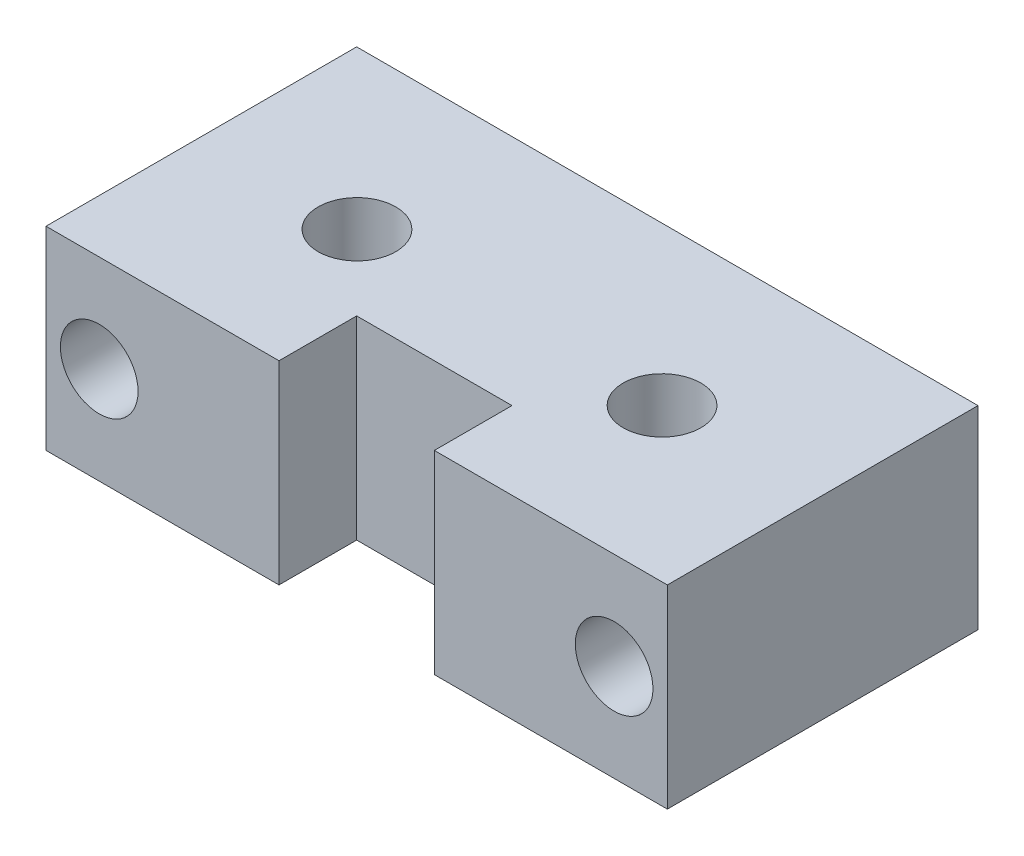
from build123d import *

# Parameters (mm, degrees)
SKETCH_1_R              = 2
EXTRUDE_1_DEPTH         = 10
CUT_EXTRUDE_START       = -16
CUT_EXTRUDE_1_OUTLINE_R = 2
CUT_EXTRUDE_1_DEPTH     = 16


# Read off the part's stored shape, not the designer's step: 切除-拉伸1
with BuildPart() as part:
    # 草图1 → 凸台-拉伸1 (new body)
    with BuildSketch(Plane(origin=(0, 0, 0), x_dir=(1, 0, 0), z_dir=(0, 1, 0))):
        Polygon((-14.375, 0), (-2.375, 0), (-2.375, 4), (5.625, 4), (5.625, 0), (17.625, 0), (17.625, 16), (-14.375, 16), align=None)
        with Locations(Location((-6.230357992, 7.870924175, 0), (0, 0, 270))):
            Circle(SKETCH_1_R, mode=Mode.SUBTRACT)
        with Locations(Location((9.480357992, 7.870924175, 0), (0, 0, 90))):
            Circle(SKETCH_1_R, mode=Mode.SUBTRACT)
    extrude(amount=EXTRUDE_1_DEPTH)

    # 切除-拉伸1 outline → 切除-拉伸1 (cut)
    with BuildSketch(Plane.XY.offset(CUT_EXTRUDE_START)):
        with Locations((14.884036252, 5)):
            Circle(CUT_EXTRUDE_1_OUTLINE_R)
        with Locations((-11.634036252, 5)):
            Circle(CUT_EXTRUDE_1_OUTLINE_R)
    extrude(amount=CUT_EXTRUDE_1_DEPTH, mode=Mode.SUBTRACT)


solid = part.part
